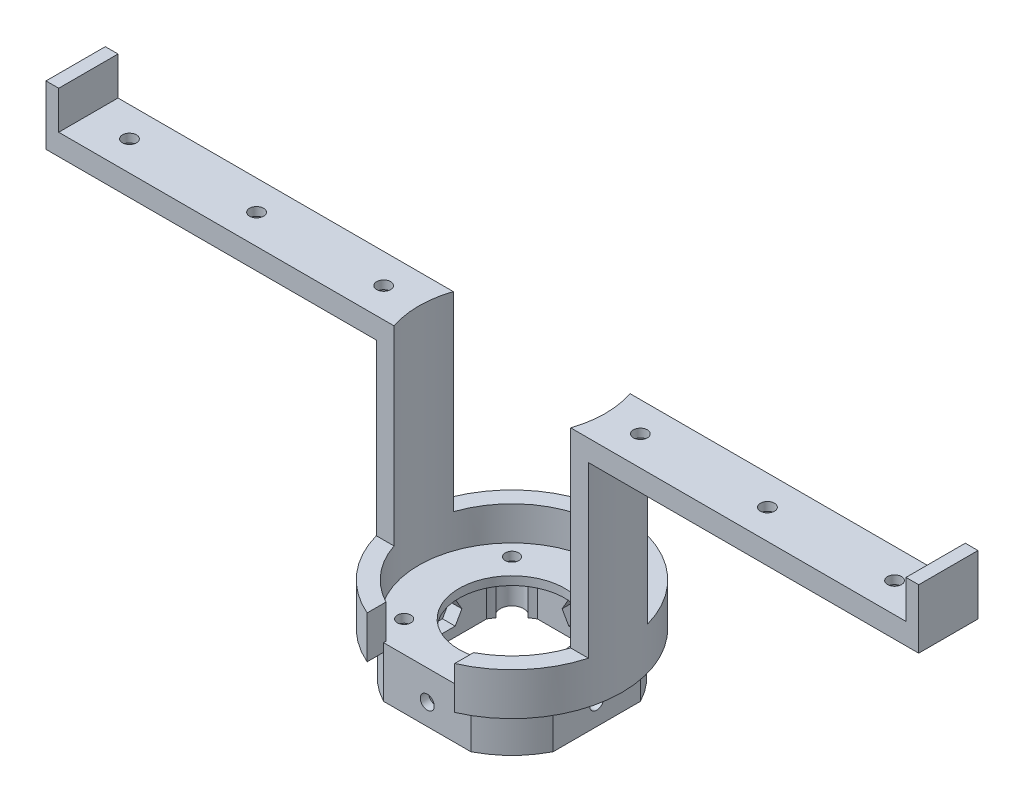
from build123d import *
from build123d.topology import SkipClean

# Parameters (mm, degrees)
SKETCH_1_R           = 1.6
EXTRUDE_1_DEPTH      = 2
SKETCH_2_R           = 12.5
CUT_EXTRUDE_1_DEPTH  = 3
SKETCH_5_R           = 26
SKETCH_5_R_2         = 22
EXTRUDE_3_DEPTH      = 10
EXTRUDE_5_DEPTH      = 10
SKETCH_15_R          = 1.65
CUT_EXTRUDE_2_DEPTH  = 42
SKETCH_16_R          = 1.65
CUT_EXTRUDE_3_DEPTH  = 42
CUT_EXTRUDE_4_DEPTH  = 18
CUT_EXTRUDE_5_DEPTH  = 18
EXTRUDE_6_DEPTH      = 45
SKETCH_24_W          = 50.26
SKETCH_24_H          = 14
EXTRUDE_7_DEPTH      = 5
SKETCH_25_R          = 1.65
CUT_EXTRUDE_6_DEPTH  = 5
CUT_EXTRUDE_7_DEPTH  = 3
CUT_EXTRUDE_9_DEPTH  = 10
CUT_EXTRUDE_START    = -8
CUT_EXTRUDE_10_DEPTH = 8
SKETCH_34_W          = 24.7
SKETCH_34_H          = 14
EXTRUDE_9_DEPTH      = 5
SKETCH_35_R          = 1.65
CUT_EXTRUDE_11_DEPTH = 5
CUT_EXTRUDE_12_DEPTH = 3
SKETCH_37_W          = 3
SKETCH_37_H          = 14
EXTRUDE_10_DEPTH     = 14


with BuildPart() as part:
    # 草图1 → 凸台-拉伸1 (new body)
    with BuildSketch(Plane(origin=(0, 0, 0), x_dir=(1, 0, 0), z_dir=(0, 1, 0))):
        with BuildLine():
            ThreePointArc((20.341082498, 8.380952381), (0, 22), (-20.341082498, 8.380952381))
            ThreePointArc((-20.341082498, 8.380952381), (-4.271778613, -21.581286048), (22, 0))
            ThreePointArc((22, 0), (21.581286048, 4.271778613), (20.341082498, 8.380952381))
        make_face()
        with Locations((-12.727922061, -12.727922061)):
            Circle(SKETCH_1_R, mode=Mode.SUBTRACT)
        with Locations((12.727922061, -12.727922061)):
            Circle(SKETCH_1_R, mode=Mode.SUBTRACT)
        with Locations((-12.727922061, 12.727922061)):
            Circle(SKETCH_1_R, mode=Mode.SUBTRACT)
        with Locations((12.727922061, 12.727922061)):
            Circle(SKETCH_1_R, mode=Mode.SUBTRACT)
    extrude(amount=EXTRUDE_1_DEPTH)

    # 草图2 → 切除-拉伸1 (cut)
    with BuildSketch(Plane(origin=(0, 2, 0), x_dir=(1, 0, 0), z_dir=(0, 1, 0))):
        Circle(SKETCH_2_R)
    extrude(amount=-CUT_EXTRUDE_1_DEPTH, mode=Mode.SUBTRACT)

    # 草图5 → 凸台-拉伸3 (add)
    with BuildSketch(Plane(origin=(0, 0, 0), x_dir=(1, 0, 0), z_dir=(0, 1, 0))):
        Circle(SKETCH_5_R)
        Circle(SKETCH_5_R_2, mode=Mode.SUBTRACT)
    extrude(amount=EXTRUDE_3_DEPTH)

    # 草图14 → 凸台-拉伸5 (add)
    with BuildSketch(Plane.XZ):
        with BuildLine():
            Line((-10.307764064, 20), (10.307764064, 20))
            ThreePointArc((10.307764064, 20), (15.909902577, 15.909902577), (20, 10.307764064))
            Line((20, 10.307764064), (20, -10.307764064))
            ThreePointArc((20, -10.307764064), (15.909902577, -15.909902577), (10.307764064, -20))
            Line((10.307764064, -20), (-10.307764064, -20))
            ThreePointArc((-10.307764064, -20), (-15.909902577, -15.909902577), (-20, -10.307764064))
            Line((-20, -10.307764064), (-20, 10.307764064))
            ThreePointArc((-20, 10.307764064), (-15.909902577, 15.909902577), (-10.307764064, 20))
        make_face()
        with BuildLine():
            Line((-9.013878189, 15), (9.013878189, 15))
            ThreePointArc((9.013878189, 15), (9.692559275, 14.570665555), (10.350828667, 14.110646544))
            ThreePointArc((10.350828667, 14.110646544), (14.67246571, 14.67246571), (14.110646544, 10.350828667))
            ThreePointArc((14.110646544, 10.350828667), (14.570665555, 9.692559275), (15, 9.013878189))
            Line((15, 9.013878189), (15, -9.013878189))
            ThreePointArc((15, -9.013878189), (14.570665555, -9.692559275), (14.110646544, -10.350828667))
            ThreePointArc((14.110646544, -10.350828667), (14.67246571, -14.67246571), (10.350828667, -14.110646544))
            ThreePointArc((10.350828667, -14.110646544), (9.692559275, -14.570665555), (9.013878189, -15))
            Line((9.013878189, -15), (-9.013878189, -15))
            ThreePointArc((-9.013878189, -15), (-9.692559275, -14.570665555), (-10.350828667, -14.110646544))
            ThreePointArc((-10.350828667, -14.110646544), (-14.67246571, -14.67246571), (-14.110646544, -10.350828667))
            ThreePointArc((-14.110646544, -10.350828667), (-14.570665555, -9.692559275), (-15, -9.013878189))
            Line((-15, -9.013878189), (-15, 9.013878189))
            ThreePointArc((-15, 9.013878189), (-14.570665555, 9.692559275), (-14.110646544, 10.350828667))
            ThreePointArc((-14.110646544, 10.350828667), (-14.67246571, 14.67246571), (-10.350828667, 14.110646544))
            ThreePointArc((-10.350828667, 14.110646544), (-9.692559275, 14.570665555), (-9.013878189, 15))
        make_face(mode=Mode.SUBTRACT)
    extrude(amount=EXTRUDE_5_DEPTH)

    # 草图15 → 切除-拉伸2 (cut)
    with BuildSketch(Plane.ZY.offset(20)):
        with Locations((0, -5)):
            Circle(SKETCH_15_R)
    extrude(amount=-CUT_EXTRUDE_2_DEPTH, mode=Mode.SUBTRACT)

    # 草图16 → 切除-拉伸3 (cut)
    with BuildSketch(Plane(origin=(0, 0, -20), x_dir=(-1, 0, 0), z_dir=(0, 0, -1))):
        with Locations((0, -5)):
            Circle(SKETCH_16_R)
    extrude(amount=-CUT_EXTRUDE_3_DEPTH, mode=Mode.SUBTRACT)

    # 草图18 → 切除-拉伸4 (cut, symmetric)
    with BuildSketch(Plane.XY):
        Polygon((-1.58771324, -2.25), (-3.175426481, -5), (-1.58771324, -7.75), (1.58771324, -7.75), (3.175426481, -5), (1.58771324, -2.25), align=None)
    extrude(amount=CUT_EXTRUDE_4_DEPTH, both=True, mode=Mode.SUBTRACT)

    # 草图19 → 切除-拉伸5 (cut, symmetric)
    with BuildSketch(Plane(origin=(0, 0, 0), x_dir=(0, 0, -1), z_dir=(1, 0, 0))):
        Polygon((-1.58771324, -2.25), (-3.175426481, -5), (-1.58771324, -7.75), (1.58771324, -7.75), (3.175426481, -5), (1.58771324, -2.25), align=None)
    extrude(amount=CUT_EXTRUDE_5_DEPTH, both=True, mode=Mode.SUBTRACT)

    # 草图23 → 凸台-拉伸6 (add)
    with SkipClean():  # the faces are left unmerged after this step: merging them gives an invalid solid
        with BuildSketch(Plane(origin=(0, 10, 0), x_dir=(1, 0, 0), z_dir=(0, 1, 0))):
            with BuildLine():
                Line((-20.856653615, 7), (-25.039968051, 7))
                ThreePointArc((-25.039968051, 7), (-26, 0), (-25.039968051, -7))
                Line((-25.039968051, -7), (-20.856653615, -7))
                ThreePointArc((-20.856653615, -7), (-22, 0), (-20.856653615, 7))
            make_face()
            with BuildLine():
                Line((25.039968051, 7), (20.856653615, 7))
                ThreePointArc((20.856653615, 7), (22, 0), (20.856653615, -7))
                Line((20.856653615, -7), (25.039968051, -7))
                ThreePointArc((25.039968051, -7), (26, 0), (25.039968051, 7))
            make_face()
        extrude(amount=EXTRUDE_6_DEPTH)

    # 草图24 → 凸台-拉伸7 (add)
    with SkipClean():  # the faces are left unmerged after this step: merging them gives an invalid solid
        with BuildSketch(Plane(origin=(0, 55, 0), x_dir=(1, 0, 0), z_dir=(0, 1, 0))):
            with Locations((-50.169968051, 0)):
                Rectangle(SKETCH_24_W, SKETCH_24_H)
        extrude_7 = extrude(amount=-EXTRUDE_7_DEPTH)

    # 镜向1: 凸台-拉伸7 across plane
    with SkipClean():  # the faces are left unmerged after this step: merging them gives an invalid solid
        add(extrude_7.mirror(Plane(origin=(0, 0, 0), x_dir=(0, 0, 1), z_dir=(1, 0, 0))))

    # 草图25 → 切除-拉伸6 (cut)
    with SkipClean():  # the faces are left unmerged after this step: merging them gives an invalid solid
        with BuildSketch(Plane(origin=(0, 55, 0), x_dir=(1, 0, 0), z_dir=(0, 1, 0))):
            with Locations((-60.299968051, 0)):
                Circle(SKETCH_25_R)
            with Locations((-30.299968051, 0)):
                Circle(SKETCH_25_R)
        cut_extrude_6 = extrude(amount=-CUT_EXTRUDE_6_DEPTH, mode=Mode.SUBTRACT)

    # 草图26 → 切除-拉伸7 (cut)
    with SkipClean():  # the faces are left unmerged after this step: merging them gives an invalid solid
        with BuildSketch(Plane(origin=(0, 50, 0), x_dir=(1, 0, 0), z_dir=(0, 1, 0))):
            Polygon((-58.712254811, 2.75), (-61.887681291, 2.75), (-63.475394532, 0), (-61.887681291, -2.75), (-58.712254811, -2.75), (-57.124541571, 0), align=None)
            Polygon((-31.887681291, 2.75), (-33.475394532, 0), (-31.887681291, -2.75), (-28.712254811, -2.75), (-27.124541571, 0), (-28.712254811, 2.75), align=None)
        cut_extrude_7 = extrude(amount=CUT_EXTRUDE_7_DEPTH, mode=Mode.SUBTRACT)

    # 镜向3: 切除-拉伸6, 切除-拉伸7 across plane
    with SkipClean():  # the faces are left unmerged after this step: merging them gives an invalid solid
        add(cut_extrude_6.mirror(Plane(origin=(0, 0, 0), x_dir=(0, 0, 1), z_dir=(1, 0, 0))), mode=Mode.SUBTRACT)
        add(cut_extrude_7.mirror(Plane(origin=(0, 0, 0), x_dir=(0, 0, 1), z_dir=(1, 0, 0))), mode=Mode.SUBTRACT)

    # 草图28 → 切除-拉伸9 (cut)
    with BuildSketch(Plane.XZ):
        with BuildLine():
            Line((-10.34, 20), (10.34, 20))
            Line((10.34, 20), (10.34, 23.855489934))
            ThreePointArc((10.34, 23.855489934), (0, 26), (-10.34, 23.855489934))
            Line((-10.34, 23.855489934), (-10.34, 20))
        make_face()
    extrude(amount=-CUT_EXTRUDE_9_DEPTH, mode=Mode.SUBTRACT)

    # 草图29 → 切除-拉伸10 (cut)
    with BuildSketch(Plane(origin=(0, 10, 0), x_dir=(1, 0, 0), z_dir=(0, 1, 0)).offset(CUT_EXTRUDE_START)):
        with BuildLine():
            Line((-10.34, -20), (-10.34, -19.418661128))
            ThreePointArc((-10.34, -19.418661128), (-9.756906344, -19.718082528), (-9.16515139, -20))
            Line((-9.16515139, -20), (-10.34, -20))
        make_face()
        with BuildLine():
            Line((10.34, -20), (10.34, -19.418661128))
            ThreePointArc((10.34, -19.418661128), (9.756906344, -19.718082528), (9.16515139, -20))
            Line((9.16515139, -20), (10.34, -20))
        make_face()
    extrude(amount=CUT_EXTRUDE_10_DEPTH, mode=Mode.SUBTRACT)

    # 草图34 → 凸台-拉伸9 (add)
    with BuildSketch(Plane.XZ.offset(-50)):
        with Locations((-87.649968051, 0)):
            Rectangle(SKETCH_34_W, SKETCH_34_H)
        with Locations((87.649968051, 0)):
            Rectangle(SKETCH_34_W, SKETCH_34_H)
    extrude(amount=-EXTRUDE_9_DEPTH)

    # 草图35 → 切除-拉伸11 (cut)
    with BuildSketch(Plane(origin=(0, 55, 0), x_dir=(1, 0, 0), z_dir=(0, 1, 0))):
        with Locations((-90.299968051, 0)):
            Circle(SKETCH_35_R)
        with Locations((90.299968051, 0)):
            Circle(SKETCH_35_R)
    extrude(amount=-CUT_EXTRUDE_11_DEPTH, mode=Mode.SUBTRACT)

    # 草图36 → 切除-拉伸12 (cut)
    with BuildSketch(Plane.XZ.offset(-50)):
        Polygon((-91.887681291, 2.75), (-93.475394532, 0), (-91.887681291, -2.75), (-88.712254811, -2.75), (-87.124541571, 0), (-88.712254811, 2.75), align=None)
        Polygon((91.887681291, 2.75), (88.712254811, 2.75), (87.124541571, 0), (88.712254811, -2.75), (91.887681291, -2.75), (93.475394532, 0), align=None)
    extrude(amount=-CUT_EXTRUDE_12_DEPTH, mode=Mode.SUBTRACT)

    # 草图37 → 凸台-拉伸10 (add)
    with BuildSketch(Plane.XZ.offset(-50)):
        with Locations((-101.499968051, 0)):
            Rectangle(SKETCH_37_W, SKETCH_37_H)
        with Locations((101.499968051, 0)):
            Rectangle(SKETCH_37_W, SKETCH_37_H)
    extrude(amount=-EXTRUDE_10_DEPTH)


solid = part.part
